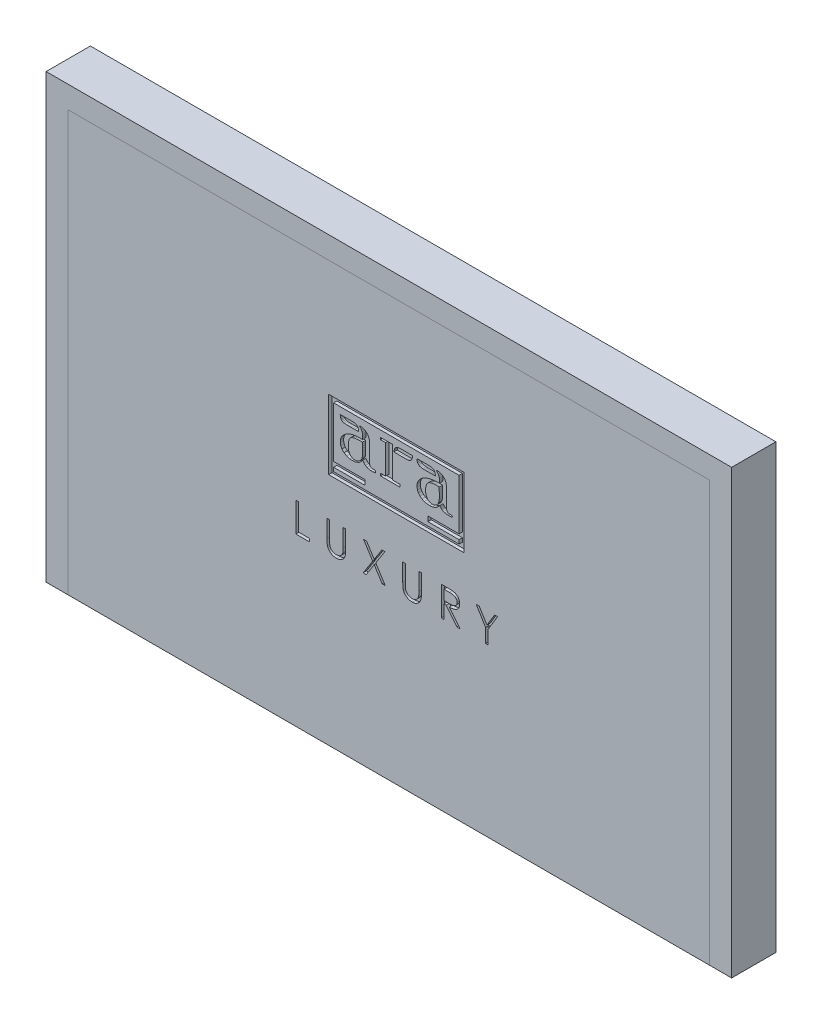
from build123d import *

# Parameters (mm, degrees)
SKETCH1_W           = 580
SKETCH1_H           = 380
BOSS_EXTRUDE3_DEPTH = 40
BOSS_EXTRUDE4_DEPTH = 40
CUT_EXTRUDE1_DEPTH  = 3
SKETCH10_W          = 122.400021213
SKETCH10_H          = 62.942093481
CUT_EXTRUDE2_DEPTH  = 3


with BuildPart() as part:
    # Sketch1 → Boss-Extrude3 (new body)
    with BuildSketch(Plane.XY):
        with Locations((0, -10)):
            Rectangle(SKETCH1_W, SKETCH1_H)
    extrude(amount=BOSS_EXTRUDE3_DEPTH)

    # Sketch8 → Cut-Extrude1 (cut)
    # profile 1 of 6: a face of its own
    with BuildSketch(Plane.XY.offset(40)):
        Polygon((-84.147998336, -22.845856613), (-81.773532524, -22.845856613), (-81.773532524, -46.590514732), (-71.597250473, -46.590514732), (-71.597250473, -49.304189946), (-84.147998336, -49.304189946), align=None)
    # profile 2 of 6: a face of its own
    with BuildSketch(Plane.XY.offset(40)):
        with BuildLine():
            Line((-55.993617994, -22.845856613), (-53.619152182, -22.845856613))
            Line((-53.619152182, -22.845856613), (-53.619152182, -38.698595996))
            add(Edge.make_bspline(
                [(-53.619152182, -38.698595996), (-53.619505544, -38.922968224), (-53.62017611, -39.348753194), (-53.615696987, -39.95478737), (-53.603152952, -40.493573222), (-53.595244484, -40.967187575), (-53.577650951, -41.373457154), (-53.56330262, -41.714583015), (-53.544853173, -41.988949902), (-53.522680202, -42.149067617), (-53.513149244, -42.217893538)],
                knots=[0, 0, 0, 0, 1.528628734, 2.90083645, 4.128790002, 5.200304208, 6.127813768, 6.898992206, 7.526736466, 8, 8, 8, 8], degree=3))
            add(Edge.make_bspline(
                [(-53.513149244, -42.217893538), (-53.474010121, -42.466199428), (-53.397937224, -42.948820059), (-53.204062821, -43.63604338), (-52.933299569, -44.25540619), (-52.612450377, -44.826235593), (-52.18962647, -45.332643255), (-51.68311165, -45.799153964), (-51.069446376, -46.207155106), (-50.387119178, -46.580223743), (-49.651689109, -46.880072877), (-48.900187274, -47.106808429), (-48.143909991, -47.244988207), (-47.637602076, -47.260988234), (-47.386179426, -47.268933536)],
                knots=[0, 0, 0, 0, 1.035780045, 2.013197591, 2.933192213, 3.817615948, 4.702609284, 5.640816605, 6.646850145, 7.73207398, 8.84249596, 9.914020372, 10.964143139, 12, 12, 12, 12], degree=3))
            add(Edge.make_bspline(
                [(-47.386179426, -47.268933536), (-47.170326745, -47.260815739), (-46.739868093, -47.244627032), (-46.100283766, -47.144376928), (-45.477378182, -46.963700033), (-44.868075423, -46.730566145), (-44.296945958, -46.42253376), (-43.763671128, -46.066700628), (-43.287693768, -45.649332696), (-42.853338666, -45.187443187), (-42.475098377, -44.666291127), (-42.147233199, -44.097224251), (-41.878674088, -43.471678593), (-41.746053395, -43.032058853), (-41.677921212, -42.806209844)],
                knots=[0, 0, 0, 0, 0.994687771, 1.983630487, 2.973142513, 3.978332533, 4.983357753, 5.956394766, 6.925816176, 7.893390482, 8.871859704, 9.88551698, 10.913711441, 12, 12, 12, 12], degree=3))
            add(Edge.make_bspline(
                [(-41.677921212, -42.806209844), (-41.655241694, -42.712860503), (-41.604702587, -42.50484055), (-41.557477901, -42.153161746), (-41.508291667, -41.738224292), (-41.474163668, -41.257046898), (-41.440892538, -40.711241926), (-41.420987761, -40.097966051), (-41.411787572, -39.419446169), (-41.409045881, -38.945939053), (-41.40761372, -38.698595996)],
                knots=[0, 0, 0, 0, 0.558680831, 1.244966039, 2.062412453, 2.990489873, 4.051219941, 5.244515665, 6.560634259, 8, 8, 8, 8], degree=3))
            Line((-41.40761372, -38.698595996), (-41.40761372, -22.845856613))
            Line((-41.40761372, -22.845856613), (-39.033147908, -22.845856613))
            Line((-39.033147908, -22.845856613), (-39.033147908, -38.825799521))
            add(Edge.make_bspline(
                [(-39.033147908, -38.825799521), (-39.035068938, -39.113805124), (-39.038817943, -39.675865569), (-39.071328253, -40.499485961), (-39.123163907, -41.280785284), (-39.196401238, -42.019868561), (-39.29344287, -42.714091075), (-39.401356739, -43.369537834), (-39.538785352, -43.98150391), (-39.699299754, -44.554760876), (-39.882796218, -45.100448984), (-40.120476327, -45.618341487), (-40.388268678, -46.124182485), (-40.705879447, -46.610321165), (-41.062775018, -47.078909989), (-41.466844272, -47.527107163), (-41.904723345, -47.962074954), (-42.383691444, -48.37265587), (-42.895853153, -48.749185749), (-43.439684976, -49.080276043), (-44.011009366, -49.36015696), (-44.608341213, -49.590540437), (-45.231935425, -49.763763895), (-45.881807728, -49.892843941), (-46.559437344, -49.966188691), (-47.020301114, -49.977088995), (-47.253675753, -49.982608749)],
                knots=[0, 0, 0, 0, 1.316592851, 2.569410997, 3.76748051, 4.895814652, 5.963796859, 6.97159953, 7.931736103, 8.829262218, 9.692595152, 10.560224239, 11.431080259, 12.30701507, 13.211635791, 14.121146779, 15.063487852, 16.031507147, 17.00238618, 17.966455255, 18.938106653, 19.907068911, 20.888905087, 21.893141452, 22.933117798, 24, 24, 24, 24], degree=3))
            add(Edge.make_bspline(
                [(-47.253675753, -49.982608749), (-47.508198136, -49.976676298), (-48.00757014, -49.965036849), (-48.743399578, -49.898341059), (-49.448810466, -49.772713911), (-50.131253108, -49.612754813), (-50.78143639, -49.392139656), (-51.408071356, -49.13437407), (-52.000425672, -48.817801923), (-52.568109085, -48.465578059), (-53.095950992, -48.069272759), (-53.580496836, -47.637320254), (-54.022546572, -47.17664002), (-54.414649217, -46.682244397), (-54.763301143, -46.157978517), (-55.063642637, -45.602359264), (-55.321522518, -45.015601755), (-55.454619781, -44.607741252), (-55.52190492, -44.401554062)],
                knots=[0, 0, 0, 0, 1.13879206, 2.234305948, 3.301075583, 4.341971843, 5.366689343, 6.369221514, 7.369726634, 8.367512178, 9.355451585, 10.318319045, 11.268648973, 12.207971039, 13.137398894, 14.081662264, 15.030215811, 16, 16, 16, 16], degree=3))
            add(Edge.make_bspline(
                [(-55.52190492, -44.401554062), (-55.56104177, -44.260700672), (-55.64593047, -43.955186531), (-55.736835994, -43.449556529), (-55.813255838, -42.867360425), (-55.885113331, -42.20855837), (-55.927514383, -41.472639735), (-55.964687878, -40.659923526), (-55.993879877, -39.76942703), (-55.993707728, -39.149133965), (-55.993617994, -38.825799521)],
                knots=[0, 0, 0, 0, 0.625038921, 1.35572334, 2.194682327, 3.136881307, 4.189498639, 5.346923369, 6.617055217, 8, 8, 8, 8], degree=3))
            Line((-55.993617994, -38.825799521), (-55.993617994, -22.845856613))
        make_face()
    # profile 3 of 6: a face of its own
    with BuildSketch(Plane.XY.offset(40)):
        Polygon((-22.920701327, -22.845856613), (-20.180525379, -22.845856613), (-13.253233379, -33.668756586), (-6.325941378, -22.845856613), (-3.58576543, -22.845856613), (-11.880495331, -35.810015934), (-3.246556028, -49.304189946), (-5.986731976, -49.304189946), (-13.253233379, -37.951275282), (-20.519734781, -49.304189946), (-23.259910729, -49.304189946), (-14.620671279, -35.810015934), align=None)
    # profile 4 of 6: a face of its own
    with BuildSketch(Plane.XY.offset(40)):
        with BuildLine():
            Line((12.526681151, -22.845856613), (14.901146963, -22.845856613))
            Line((14.901146963, -22.845856613), (14.901146963, -38.698595996))
            add(Edge.make_bspline(
                [(14.901146963, -38.698595996), (14.900793601, -38.922968224), (14.900123036, -39.348753194), (14.904602158, -39.95478737), (14.917146193, -40.493573222), (14.925054661, -40.967187575), (14.942648195, -41.373457154), (14.956996525, -41.714583015), (14.975445972, -41.988949902), (14.997618943, -42.149067617), (15.007149901, -42.217893538)],
                knots=[0, 0, 0, 0, 1.528628734, 2.90083645, 4.128790002, 5.200304208, 6.127813768, 6.898992206, 7.526736466, 8, 8, 8, 8], degree=3))
            add(Edge.make_bspline(
                [(15.007149901, -42.217893538), (15.046289024, -42.466199428), (15.122361921, -42.948820059), (15.316236325, -43.63604338), (15.586999576, -44.25540619), (15.907848768, -44.826235593), (16.330672675, -45.332643255), (16.837187496, -45.799153964), (17.45085277, -46.207155106), (18.133179967, -46.580223743), (18.868610037, -46.880072877), (19.620111872, -47.106808429), (20.376389155, -47.244988207), (20.882697069, -47.260988234), (21.13411972, -47.268933536)],
                knots=[0, 0, 0, 0, 1.035780045, 2.013197591, 2.933192213, 3.817615948, 4.702609284, 5.640816605, 6.646850145, 7.73207398, 8.84249596, 9.914020372, 10.964143139, 12, 12, 12, 12], degree=3))
            add(Edge.make_bspline(
                [(21.13411972, -47.268933536), (21.3499724, -47.260815739), (21.780431053, -47.244627032), (22.42001538, -47.144376928), (23.042920963, -46.963700033), (23.652223722, -46.730566145), (24.223353187, -46.42253376), (24.756628017, -46.066700628), (25.232605377, -45.649332696), (25.666960479, -45.187443187), (26.045200768, -44.666291127), (26.373065946, -44.097224251), (26.641625057, -43.471678593), (26.774245751, -43.032058853), (26.842377933, -42.806209844)],
                knots=[0, 0, 0, 0, 0.994687771, 1.983630487, 2.973142513, 3.978332533, 4.983357753, 5.956394766, 6.925816176, 7.893390482, 8.871859704, 9.88551698, 10.913711441, 12, 12, 12, 12], degree=3))
            add(Edge.make_bspline(
                [(26.842377933, -42.806209844), (26.865057451, -42.712860503), (26.915596559, -42.50484055), (26.962821244, -42.153161746), (27.012007478, -41.738224292), (27.046135477, -41.257046898), (27.079406608, -40.711241926), (27.099311384, -40.097966051), (27.108511574, -39.419446169), (27.111253264, -38.945939053), (27.112685425, -38.698595996)],
                knots=[0, 0, 0, 0, 0.558680831, 1.244966039, 2.062412453, 2.990489873, 4.051219941, 5.244515665, 6.560634259, 8, 8, 8, 8], degree=3))
            Line((27.112685425, -38.698595996), (27.112685425, -22.845856613))
            Line((27.112685425, -22.845856613), (29.487151237, -22.845856613))
            Line((29.487151237, -22.845856613), (29.487151237, -38.825799521))
            add(Edge.make_bspline(
                [(29.487151237, -38.825799521), (29.485230208, -39.113805124), (29.481481203, -39.675865569), (29.448970892, -40.499485961), (29.397135239, -41.280785284), (29.323897907, -42.019868561), (29.226856276, -42.714091075), (29.118942406, -43.369537834), (28.981513793, -43.98150391), (28.820999392, -44.554760876), (28.637502927, -45.100448984), (28.399822818, -45.618341487), (28.132030467, -46.124182485), (27.814419698, -46.610321165), (27.457524127, -47.078909989), (27.053454874, -47.527107163), (26.6155758, -47.962074954), (26.136607701, -48.37265587), (25.624445992, -48.749185749), (25.080614169, -49.080276043), (24.509289779, -49.36015696), (23.911957933, -49.590540437), (23.28836372, -49.763763895), (22.638491418, -49.892843941), (21.960861802, -49.966188691), (21.499998032, -49.977088995), (21.266623392, -49.982608749)],
                knots=[0, 0, 0, 0, 1.316592851, 2.569410997, 3.76748051, 4.895814652, 5.963796859, 6.97159953, 7.931736103, 8.829262218, 9.692595152, 10.560224239, 11.431080259, 12.30701507, 13.211635791, 14.121146779, 15.063487852, 16.031507147, 17.00238618, 17.966455255, 18.938106653, 19.907068911, 20.888905087, 21.893141452, 22.933117798, 24, 24, 24, 24], degree=3))
            add(Edge.make_bspline(
                [(21.266623392, -49.982608749), (21.012101009, -49.976676298), (20.512729005, -49.965036849), (19.776899568, -49.898341059), (19.071488679, -49.772713911), (18.389046037, -49.612754813), (17.738862755, -49.392139656), (17.112227789, -49.13437407), (16.519873473, -48.817801923), (15.95219006, -48.465578059), (15.424348154, -48.069272759), (14.939802309, -47.637320254), (14.497752573, -47.17664002), (14.105649928, -46.682244397), (13.756998003, -46.157978517), (13.456656509, -45.602359264), (13.198776627, -45.015601755), (13.065679365, -44.607741252), (12.998394226, -44.401554062)],
                knots=[0, 0, 0, 0, 1.13879206, 2.234305948, 3.301075583, 4.341971843, 5.366689343, 6.369221514, 7.369726634, 8.367512178, 9.355451585, 10.318319045, 11.268648973, 12.207971039, 13.137398894, 14.081662264, 15.030215811, 16, 16, 16, 16], degree=3))
            add(Edge.make_bspline(
                [(12.998394226, -44.401554062), (12.959257375, -44.260700672), (12.874368675, -43.955186531), (12.783463151, -43.449556529), (12.707043308, -42.867360425), (12.635185814, -42.20855837), (12.592784763, -41.472639735), (12.555611268, -40.659923526), (12.526419269, -39.76942703), (12.526591417, -39.149133965), (12.526681151, -38.825799521)],
                knots=[0, 0, 0, 0, 0.625038921, 1.35572334, 2.194682327, 3.136881307, 4.189498639, 5.346923369, 6.617055217, 8, 8, 8, 8], degree=3))
            Line((12.526681151, -38.825799521), (12.526681151, -22.845856613))
        make_face()
    # profile 5 of 6: a face of its own
    with BuildSketch(Plane.XY.offset(40)):
        with BuildLine():
            Line((47.465249527, -22.845856613), (52.760096282, -22.845856613))
            add(Edge.make_bspline(
                [(52.760096282, -22.845856613), (53.113436956, -22.847032769), (53.791890191, -22.849291118), (54.763842889, -22.861883493), (55.647000111, -22.897975348), (56.440900086, -22.929034283), (57.145528252, -22.985669792), (57.763045271, -23.039800874), (58.290607032, -23.110661286), (58.609965551, -23.176470138), (58.754562428, -23.206266602)],
                knots=[0, 0, 0, 0, 1.410062039, 2.707475311, 3.878576406, 4.937260626, 5.877586885, 6.699081471, 7.410979367, 8, 8, 8, 8], degree=3))
            add(Edge.make_bspline(
                [(58.754562428, -23.206266602), (58.948136313, -23.254093935), (59.331154626, -23.348728315), (59.882622387, -23.548750298), (60.408117574, -23.780220079), (60.905457318, -24.052088679), (61.372150501, -24.366374216), (61.81300916, -24.717651094), (62.230033794, -25.103997233), (62.606359213, -25.535153475), (62.961196091, -25.987488995), (63.260467256, -26.476618585), (63.518447192, -26.988107513), (63.723843362, -27.527157636), (63.889230424, -28.088541268), (64.005845447, -28.677343482), (64.075780021, -29.290881805), (64.0829, -29.709361235), (64.086510211, -29.921552726)],
                knots=[0, 0, 0, 0, 1.027469482, 2.033020251, 3.019912614, 3.986113645, 4.951240523, 5.91722682, 6.890402269, 7.87763091, 8.8651537, 9.85103654, 10.82876324, 11.815024772, 12.821070561, 13.842952187, 14.906261191, 16, 16, 16, 16], degree=3))
            add(Edge.make_bspline(
                [(64.086510211, -29.921552726), (64.075405285, -30.27409191), (64.053736698, -30.961987167), (63.85170764, -31.960304545), (63.520777997, -32.891557102), (63.064762657, -33.754572281), (62.484044002, -34.532527755), (61.786112545, -35.215836554), (60.970578935, -35.787638274), (60.21138113, -36.1841565), (59.540744025, -36.438102893), (58.988646958, -36.61678251), (58.386402545, -36.754834272), (57.739781027, -36.878509077), (57.046091488, -36.971882005), (56.306996548, -37.040269952), (55.521969092, -37.083011867), (54.982679699, -37.089377023), (54.705250195, -37.092651484)],
                knots=[0, 0, 0, 0, 1.260483769, 2.459530307, 3.627416485, 4.787058657, 5.939039949, 7.08810263, 8.267026773, 9.491475466, 10.141966685, 10.831826277, 11.566392101, 12.351337768, 13.187381173, 14.07005841, 15.007169909, 16, 16, 16, 16], degree=3))
            Line((54.705250195, -37.092651484), (64.425719613, -49.304189946))
            Line((64.425719613, -49.304189946), (61.489438229, -49.304189946))
            Line((61.489438229, -49.304189946), (51.768968812, -37.092651484))
            Line((51.768968812, -37.092651484), (49.839715339, -37.092651484))
            Line((49.839715339, -37.092651484), (49.839715339, -49.304189946))
            Line((49.839715339, -49.304189946), (47.465249527, -49.304189946))
            Line((47.465249527, -49.304189946), (47.465249527, -22.845856613))
        make_face()
        with BuildLine():
            Line((49.839715339, -25.559531826), (49.839715339, -34.378976271))
            Line((49.839715339, -34.378976271), (54.684049608, -34.416077299))
            add(Edge.make_bspline(
                [(54.684049608, -34.416077299), (54.910230854, -34.416177362), (55.34863453, -34.416371312), (55.982883603, -34.386180265), (56.573434448, -34.351834943), (57.118028229, -34.2993012), (57.616908233, -34.231597562), (58.069825107, -34.146908336), (58.477518177, -34.048240958), (58.953001176, -33.895526287), (59.483955907, -33.65357603), (60.060985396, -33.301563034), (60.552372116, -32.858808383), (60.967525003, -32.352520947), (61.301122491, -31.795865971), (61.536314807, -31.195516037), (61.685558269, -30.566627171), (61.703160964, -30.134387903), (61.712044399, -29.916252579)],
                knots=[0, 0, 0, 0, 1.146690395, 2.22261258, 3.21895312, 4.145990853, 4.996080663, 5.770904154, 6.481378293, 7.121626537, 8.300444488, 9.431385265, 10.535395872, 11.636531494, 12.74115979, 13.810798291, 14.895190096, 16, 16, 16, 16], degree=3))
            add(Edge.make_bspline(
                [(61.712044399, -29.916252579), (61.702956936, -29.703477885), (61.684948901, -29.281836081), (61.537925472, -28.664556283), (61.28929741, -28.081966838), (60.954242397, -27.536437696), (60.5460345, -27.041245526), (60.067381987, -26.617555738), (59.531372476, -26.267931809), (59.030393774, -26.044514766), (58.582611335, -25.907537303), (58.193827595, -25.811144577), (57.754532496, -25.73370127), (57.262593017, -25.671652239), (56.72010926, -25.61832022), (56.124338267, -25.582399036), (55.479232845, -25.561127563), (55.03211021, -25.560076117), (54.800652839, -25.559531826)],
                knots=[0, 0, 0, 0, 1.101028733, 2.181837193, 3.264309656, 4.369019818, 5.486613113, 6.575447106, 7.666700264, 8.788928104, 9.402425223, 10.0903467, 10.862060571, 11.710948788, 12.657782767, 13.684531032, 14.801375019, 16, 16, 16, 16], degree=3))
            Line((54.800652839, -25.559531826), (49.839715339, -25.559531826))
        make_face(mode=Mode.SUBTRACT)
    # profile 6 of 6: a face of its own
    with BuildSketch(Plane.XY.offset(40)):
        Polygon((79.011723886, -22.845856613), (81.730699247, -22.845856613), (88.684491982, -34.214671717), (95.627684423, -22.845856613), (98.346659784, -22.845856613), (89.866424741, -36.726941348), (89.866424741, -49.304189946), (87.491958929, -49.304189946), (87.491958929, -36.726941348), align=None)
    extrude(amount=-CUT_EXTRUDE1_DEPTH, mode=Mode.SUBTRACT)

    # Sketch10 → Cut-Extrude2 (cut)
    # profile 1 of 7: a face of its own
    with BuildSketch(Plane.XY.offset(40)):
        with Locations((6.732117932, 43.528953259)):
            Rectangle(SKETCH10_W, SKETCH10_H)
        Polygon((-49.967892674, 16.557906519), (-49.967892674, 20.065417749), (-21.431415904, 20.065417749), (-21.431415904, 24.565417749), (-49.967892674, 24.565417749), (-49.967892674, 70.5), (63.432128539, 70.5), (63.432128539, 24.565417749), (35.297069127, 24.565417749), (35.297069127, 20.065417749), (63.432128539, 20.065417749), (63.432128539, 16.557906519), align=None, mode=Mode.SUBTRACT)
    # profile 2 of 7: a face of its own
    with BuildSketch(Plane.XY.offset(40)):
        Polygon((-14.404720268, 34.209753607), (-12.146848903, 34.566081738), (-12.146848903, 36.393263232), (-12.305854219, 36.409523464), (-12.456073787, 36.426115143), (-12.59899698, 36.442221611), (-12.736113172, 36.457026213), (-12.868911734, 36.469712292), (-12.99888204, 36.479463192), (-13.127513463, 36.485462256), (-14.627583813, 36.563208056), (-15.739230411, 36.732911983), (-16.520166061, 37.054273668), (-17.028103567, 37.586992742), (-17.320755732, 38.390768834), (-17.455835361, 39.525301577), (-17.491055256, 41.050290601), (-17.492176522, 43.311374229), (-17.48797927, 45.572727228), (-17.484670857, 47.834116675), (-17.488458642, 50.095309647), (-17.505549982, 52.356073218), (-17.542152232, 54.616174467), (-17.604472752, 56.875380469), (-17.919449635, 58.74631335), (-18.684733487, 60.432879507), (-19.830443099, 61.881308894), (-21.286697258, 63.037831467), (-22.983614752, 63.848677181), (-24.851314371, 64.26007599), (-26.819914903, 64.218257849), (-25.632862134, 63.149900184), (-24.789210806, 61.976046918), (-24.237141964, 60.705020086), (-23.924836656, 59.345141725), (-23.800475927, 57.90473387), (-23.812240823, 56.392118557), (-23.908312391, 54.815617822), (-24.502598946, 54.818083358), (-25.08425879, 54.823717565), (-25.655306516, 54.829876847), (-26.217756713, 54.833917607), (-26.77362397, 54.833196246), (-27.324922877, 54.825069168), (-27.873668025, 54.806892773), (-29.456417239, 54.696869494), (-31.01709324, 54.501591048), (-32.552837587, 54.212322516), (-34.060791841, 53.820328977), (-35.538097563, 53.316875512), (-36.981896312, 52.6932272), (-38.389329649, 51.940649121), (-40.476664604, 50.417879421), (-42.097844387, 48.629805174), (-43.232039134, 46.647759094), (-43.858418983, 44.543073893), (-43.956154071, 42.387082284), (-43.504414535, 40.25111698), (-42.482370512, 38.206510693), (-40.552469825, 36.149144294), (-38.058786655, 34.723272523), (-35.215646172, 33.938544912), (-32.237373549, 33.804610989), (-29.338293956, 34.331120285), (-26.732732564, 35.527722329), (-24.635014546, 37.40406665), (-24.500023426, 37.574001983), (-24.365476656, 37.745062638), (-24.230804026, 37.91753678), (-24.095435331, 38.091712575), (-23.958800363, 38.267878186), (-23.820328915, 38.446321779), (-23.679450779, 38.627331519), (-22.531552526, 37.069078839), (-21.25402901, 35.850706696), (-19.824732128, 34.963901594), (-18.221513779, 34.400350041), (-16.42222586, 34.151738543), align=None)
        Polygon((-36.431037482, 46.033752529), (-36.331009701, 47.06308837), (-36.210501014, 48.086847144), (-36.055319219, 48.799551814), (-35.785584853, 49.450498127), (-35.412327048, 50.037198528), (-34.946574936, 50.557165461), (-34.399357649, 51.00791137), (-33.78170432, 51.386948699), (-33.104644081, 51.691789893), (-31.831919749, 52.108007961), (-30.545440966, 52.407153157), (-29.248067878, 52.605125221), (-27.942660634, 52.717823895), (-26.632079382, 52.76114892), (-25.319184271, 52.751000038), (-24.006835447, 52.70327699), (-24.001631138, 51.022493109), (-23.989913082, 49.365559695), (-23.977523592, 47.728677074), (-23.970304977, 46.108045573), (-23.974099548, 44.499865519), (-23.994749617, 42.900337239), (-24.038097493, 41.30566106), (-24.268886823, 40.009572255), (-24.82906459, 38.782813248), (-25.660841537, 37.671699958), (-26.706428403, 36.722548306), (-27.908035932, 35.981674212), (-29.207874864, 35.495393595), (-30.54815594, 35.310022375), (-31.835810138, 35.428660032), (-33.032843385, 35.808604947), (-34.106105639, 36.42839227), (-35.022446859, 37.266557151), (-35.748717004, 38.30163474), (-36.251766032, 39.512160186), (-36.498443904, 40.87666864), (-36.554614467, 41.90249639), (-36.572372851, 42.93321155), (-36.555305312, 43.966721223), (-36.506998104, 45.000932514), align=None, mode=Mode.SUBTRACT)
    # profile 3 of 7: a face of its own
    with BuildSketch(Plane.XY.offset(40)):
        Polygon((-30.90961876, 64.312377686), (-32.779360661, 64.390093303), (-34.651215674, 64.428562715), (-36.524644915, 64.43773273), (-38.399109498, 64.427550152), (-40.274070539, 64.40796179), (-42.148989153, 64.388914447), (-44.023326454, 64.380354932), (-43.926143065, 63.194208159), (-43.664589927, 62.13435325), (-43.239167626, 61.217621641), (-42.65037675, 60.460844767), (-41.898717884, 59.880854066), (-40.984691616, 59.494480972), (-39.90879853, 59.318556921), (-38.103466438, 59.240686591), (-36.295871456, 59.202828437), (-34.486576103, 59.194765142), (-32.676142899, 59.206279389), (-30.865134361, 59.227153863), (-29.05411301, 59.247171245), (-27.243641365, 59.256114221), (-27.342984826, 60.406985122), (-27.591241932, 61.455333756), (-27.983938015, 62.376963975), (-28.516598406, 63.147679627), (-29.184748439, 63.743284563), (-29.983913447, 64.139582632), align=None)
    # profile 4 of 7: a face of its own
    with BuildSketch(Plane.XY.offset(40)):
        Polygon((-7.779953825, 64.649366418), (-7.779953825, 62.813264539), (-2.995151698, 62.813264539), (-2.995151698, 36.592637109), (-7.566507551, 36.592637109), (-7.566507551, 34.45962312), (10.036669133, 34.45962312), (10.036669133, 36.68587793), (3.432214122, 36.68587793), (3.432214122, 64.649366418), align=None)
    # profile 5 of 7: a face of its own
    with BuildSketch(Plane.XY.offset(40)):
        Polygon((11.483793759, 64.829683746), (9.832297887, 64.800654858), (8.473925841, 64.662864503), (7.326261674, 64.314105724), (6.383958678, 63.750670538), (5.641670147, 62.96885096), (5.094049373, 61.964939006), (4.735749648, 60.735226691), (4.561424266, 59.27600603), (6.361423888, 59.26775632), (8.152247801, 59.249251137), (9.935019334, 59.229856403), (11.710861817, 59.218938038), (13.480898579, 59.225861962), (15.24625295, 59.259994098), (17.008048259, 59.330700366), (18.153962794, 59.512987673), (19.132258894, 59.92099732), (19.939626367, 60.539708867), (20.572755021, 61.354101872), (21.028334664, 62.349155895), (21.303055105, 63.509850496), (21.393606151, 64.821165234), (19.742528858, 64.824677882), (18.091052918, 64.832595007), (16.439309885, 64.840985382), (14.787431311, 64.845917781), (13.135548752, 64.843460978), align=None)
    # profile 6 of 7: a face of its own
    with BuildSketch(Plane.XY.offset(40)):
        Polygon((41.256417145, 62.573305953), (40.66338761, 63.337207783), (39.91782842, 63.907059758), (39.017422582, 64.275625301), (37.959853105, 64.435667834), (36.173164536, 64.500066656), (34.383398698, 64.531402285), (32.589427707, 64.538114642), (30.790123675, 64.52864365), (28.984358719, 64.511429228), (27.171004953, 64.494911299), (25.34893449, 64.487529785), (25.453897566, 63.170171372), (25.770536378, 62.03456627), (26.29592913, 61.085054032), (27.027154027, 60.325974215), (27.961289273, 59.761666372), (29.09541307, 59.396470058), (30.426603624, 59.234724829), (31.466209034, 59.201296779), (32.5064668, 59.1835663), (33.547200095, 59.177529839), (34.58823209, 59.179183843), (35.629385957, 59.184524761), (36.670484868, 59.189549039), (37.711351995, 59.190253125), (38.343742583, 59.18894955), (38.976228561, 59.188371512), (39.608907314, 59.188327661), (40.241876224, 59.188626646), (40.875232676, 59.189077117), (41.509074054, 59.189487723), (42.14349774, 59.189667114), (41.994155219, 60.492299041), (41.699234018, 61.622590847), align=None)
    # profile 7 of 7: a face of its own
    with BuildSketch(Plane.XY.offset(40)):
        Polygon((28.199704146, 36.484750197), (30.024632811, 35.157496802), (32.057354536, 34.246264999), (34.349319952, 33.629993646), (36.797426764, 33.396709641), (39.298572673, 33.634439886), (41.749655382, 34.431211281), (44.047572595, 35.875050725), (46.089222014, 38.05398512), (46.401526492, 37.688708792), (46.698929269, 37.322577652), (46.988663506, 36.962167662), (47.277962364, 36.614054786), (47.574059003, 36.284814987), (47.884186585, 35.981024228), (48.21557827, 35.709258472), (49.395465292, 35.015294471), (50.621461223, 34.592224613), (51.882959496, 34.379428395), (53.169353543, 34.31628531), (54.470036799, 34.342174855), (55.774402697, 34.396476524), (57.07184467, 34.418569812), (57.143101972, 34.444510611), (57.22484283, 34.515021257), (57.30830214, 34.617083087), (57.384714799, 34.737677434), (57.445315704, 34.863785636), (57.481339751, 34.982389028), (57.484021837, 35.080468945), (57.448197636, 35.199674389), (57.390008496, 35.322217075), (57.313539694, 35.44215375), (57.222876505, 35.553541161), (57.122104203, 35.650436054), (57.015308064, 35.726895174), (56.906573363, 35.776975269), (56.741628756, 35.817664384), (56.570326588, 35.838727551), (56.394296184, 35.845123363), (56.215166871, 35.841810419), (56.034567975, 35.833747313), (55.854128823, 35.825892643), (55.67547874, 35.823205005), (54.603793466, 35.884948744), (53.756421601, 36.063679363), (53.111542074, 36.380788246), (52.647333817, 36.857666779), (52.341975759, 37.515706348), (52.173646831, 38.376298336), (52.120525963, 39.460834131), (52.118660913, 41.898393556), (52.120917586, 44.33609991), (52.122330552, 46.773821072), (52.117934379, 49.211424917), (52.10276364, 51.648779324), (52.071852902, 54.085752168), (52.020236736, 56.522211328), (51.737621096, 58.484970214), (51.02877433, 60.227741578), (49.940415845, 61.712001906), (48.519265049, 62.899227683), (46.812041349, 63.750895394), (44.865464153, 64.228481525), (42.726252867, 64.293462561), (43.883295105, 63.237544194), (44.729786957, 62.092882501), (45.304691591, 60.867497687), (45.646972169, 59.569409953), (45.795591859, 58.206639504), (45.789513825, 56.787206544), (45.667701232, 55.319131274), (44.965759644, 55.288772805), (44.269071937, 55.262610946), (43.576996003, 55.237347752), (42.888889737, 55.209685273), (42.204111032, 55.176325563), (41.522017782, 55.133970673), (40.841967882, 55.079322656), (38.552321118, 54.798643443), (36.339969115, 54.355348242), (34.223214883, 53.712482499), (32.220361435, 52.833091657), (30.349711782, 51.680221164), (28.629568937, 50.216916462), (27.078235912, 48.406222998), (25.985333376, 46.432874821), (25.433636818, 44.324834722), (25.401185928, 42.179052457), (25.866020393, 40.092477778), (26.806179903, 38.16206044), align=None)
        Polygon((35.313515442, 50.429378197), (35.690202131, 50.722866026), (36.092002143, 50.983123799), (36.50527891, 51.205238481), (36.916395867, 51.384297034), (38.117785468, 51.784580622), (39.333644808, 52.075621329), (40.559272703, 52.269871171), (41.789967967, 52.379782165), (43.021029417, 52.417806327), (44.247755867, 52.396395674), (45.465446135, 52.328002222), (45.488602909, 50.705591333), (45.541152193, 49.088492696), (45.597712433, 47.478976891), (45.632902074, 45.879314494), (45.621339562, 44.291776085), (45.537643342, 42.718632241), (45.356431859, 41.16215354), (44.759071311, 39.239162232), (43.693334702, 37.689676744), (42.279854534, 36.554029879), (40.639263311, 35.872554437), (38.892193539, 35.68558322), (37.159277719, 36.03344903), (35.561148357, 36.956484668), (35.375092794, 37.112299552), (35.190060898, 37.275811166), (35.010572471, 37.4472456), (34.841147312, 37.626828943), (34.686305221, 37.814787285), (34.550565998, 38.011346716), (34.438449443, 38.216733325), (33.794000265, 39.81526888), (33.363549795, 41.418735126), (33.148504402, 43.023950292), (33.150270455, 44.627732608), (33.370254322, 46.226900302), (33.809862373, 47.818271605), (34.470500975, 49.398664746), (34.690028297, 49.762364521), (34.975578641, 50.10757335), align=None, mode=Mode.SUBTRACT)
    extrude(amount=-CUT_EXTRUDE2_DEPTH, mode=Mode.SUBTRACT)


with BuildPart() as body_2:
    # Sketch1<6> → Boss-Extrude4 (new body)
    with BuildSketch(Plane.XY):
        Polygon((290, 180), (290, -200), (310, -200), (310, 180), (310, 200), (290, 200), (-290, 200), (-310, 200), (-310, 180), (-310, -200), (-290, -200), (-290, 180), align=None)
    extrude(amount=BOSS_EXTRUDE4_DEPTH)


solid = Compound([part.part, body_2.part])
